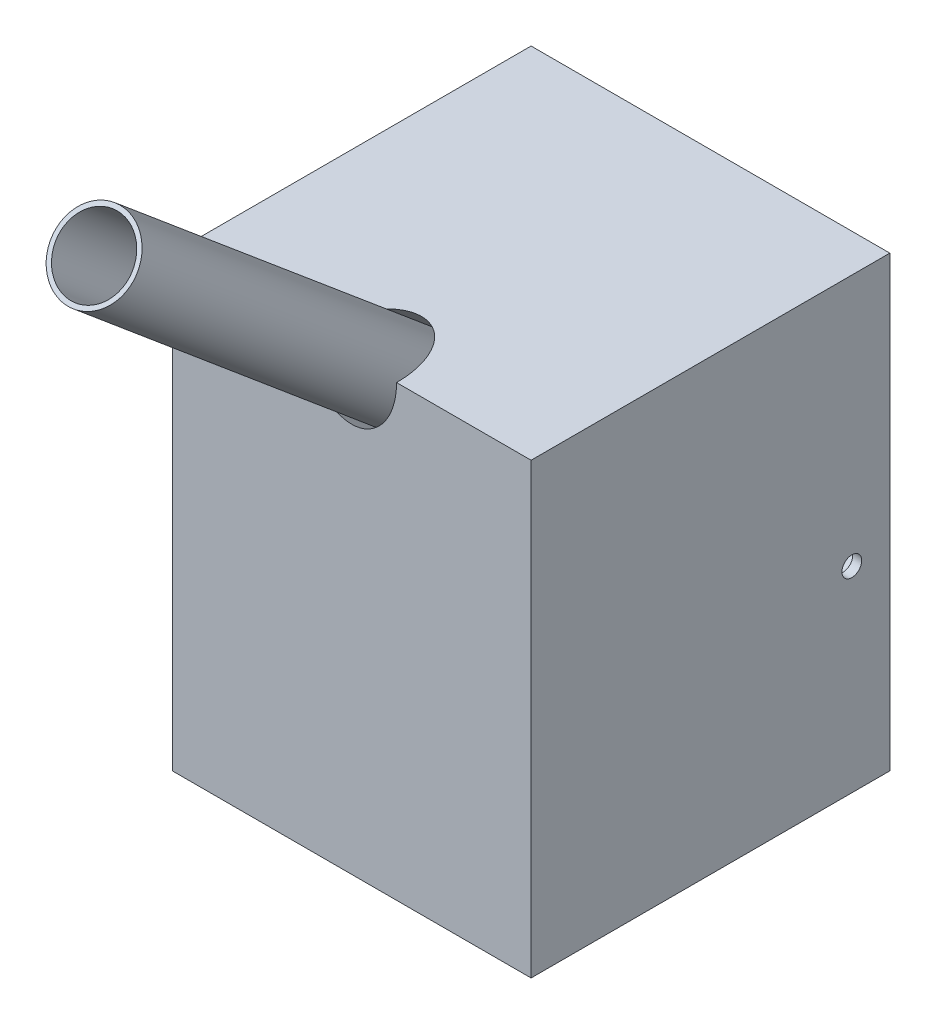
from build123d import *

# Parameters (mm, degrees)
BOSS_EXTRUDE1_START      = 7.5
BOSS_EXTRUDE1_OUTLINE_W  = 40
BOSS_EXTRUDE1_OUTLINE_H  = 50
BOSS_EXTRUDE1_DEPTH      = 40
SKETCH2_W                = 30
SKETCH2_H                = 40
CUT_EXTRUDE1_DEPTH       = 35
SKETCH5_R                = 5
CUT_EXTRUDE2_DEPTH       = 23
SKETCH6_R                = 1.1
CUT_EXTRUDE3_DEPTH       = 88
BOSS_EXTRUDE2_DEPTH      = 37.5
BOSS_EXTRUDE2_DEPTH_BACK = 37.5
SKETCH10_R               = 4.5
SKETCH11_R               = 4
CUT_EXTRUDE6_DEPTH       = 7553.882843097
CUT_EXTRUDE7_START       = -1
SKETCH12_R               = 3.05
CUT_EXTRUDE7_DEPTH       = 13


# Read off the part's stored shape, not the designer's step: Boss-Extrude1
with BuildPart() as part:
    # Boss-Extrude1 outline → Boss-Extrude1 (new body)
    with BuildSketch(Plane.XY.offset(BOSS_EXTRUDE1_START)):
        with Locations((6076.774193548, -5728.225806452)):
            Rectangle(BOSS_EXTRUDE1_OUTLINE_W, BOSS_EXTRUDE1_OUTLINE_H)
    extrude(amount=BOSS_EXTRUDE1_DEPTH)

    # Sketch2 → Cut-Extrude1 (cut)
    with BuildSketch(Plane(origin=(0, 0, 7.5), x_dir=(-1, 0, 0), z_dir=(0, 0, -1))):
        with Locations((-6076.774193548, -5728.225806452)):
            Rectangle(SKETCH2_W, SKETCH2_H)
    extrude(amount=-CUT_EXTRUDE1_DEPTH, mode=Mode.SUBTRACT)

    # Sketch5 → Cut-Extrude2 (cut)
    with BuildSketch(Plane(origin=(0, -2333.046335035, -2780.416351467), x_dir=(-1, 0, 0), z_dir=(0, -0.6427876096865405, -0.766044443118977))):
        with Locations(Location((-6076.774193548, -4399.456848345, 0), (0, 0, 352.919898765))):
            Circle(SKETCH5_R)
    extrude(amount=CUT_EXTRUDE2_DEPTH, mode=Mode.SUBTRACT)

    # Sketch6 → Cut-Extrude3 (cut)
    with BuildSketch(Plane.ZY.offset(-6056.774193548)):
        with Locations((11.735762475, -5731.341961902)):
            Circle(SKETCH6_R)
    extrude(amount=-CUT_EXTRUDE3_DEPTH, mode=Mode.SUBTRACT)

    # Sketch12 → Cut-Extrude7 (cut)
    with BuildSketch(Plane(origin=(6096.774193548, 0, 0), x_dir=(0, 0, -1), z_dir=(1, 0, 0)).offset(CUT_EXTRUDE7_START)):
        with Locations(Location((-11.735762475, -5731.341961902, 0), (0, 0, 90))):
            Circle(SKETCH12_R)
    extrude(amount=-CUT_EXTRUDE7_DEPTH, mode=Mode.SUBTRACT)


with BuildPart() as body_2:
    # Sketch10 → Boss-Extrude2 (new, two sides: drawn at the far end of the back side and taken through both)
    with BuildSketch(Plane(origin=(0, -2333.046335035, -2780.416351467), x_dir=(-1, 0, 0), z_dir=(0, -0.6427876096865405, -0.766044443118977)).offset(-BOSS_EXTRUDE2_DEPTH_BACK)):
        with Locations(Location((-6076.774193548, -4399.456848345, 0), (0, 0, 90))):
            Circle(SKETCH10_R)
    extrude(amount=BOSS_EXTRUDE2_DEPTH + BOSS_EXTRUDE2_DEPTH_BACK)

    # Sketch11 → Cut-Extrude6 (cut, through all)
    with BuildSketch(Plane(origin=(0, -2357.150870398, -2809.143018084), x_dir=(1, 0, 0), z_dir=(0, -0.6427876096865406, -0.766044443118977))):
        with Locations(Location((6076.774193548, 4399.456848345, 0), (0, 0, 270))):
            Circle(SKETCH11_R)
    extrude(amount=-CUT_EXTRUDE6_DEPTH, mode=Mode.SUBTRACT)


solid = Compound([part.part, body_2.part])
